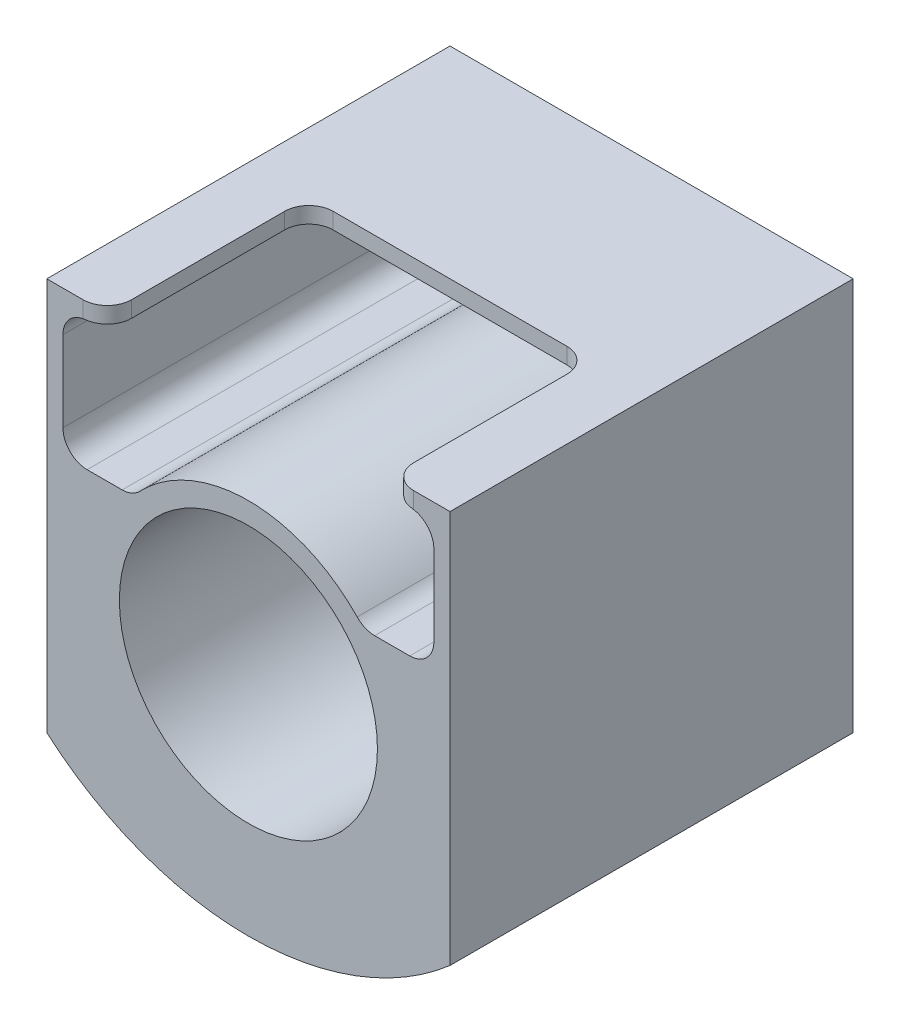
from build123d import *

# Parameters (mm, degrees)
BOSS_EXTRUDE2_DEPTH     = 50
CUT_EXTRUDE1_DEPTH      = 68.650646708
CUT_EXTRUDE1_DEPTH_BACK = 68.650646708
SKETCH2_R               = 16
CUT_EXTRUDE3_DEPTH      = 68.650646708
FILLET1_R               = 3
SKETCH5_W               = 35
SKETCH5_H               = 25
CUT_EXTRUDE4_DEPTH      = 10
FILLET2_R               = 3
SKETCH6_R               = 9.5
SKETCH6_R_2             = 1.25
BOSS_EXTRUDE3_DEPTH     = 5
CUT_EXTRUDE5_DEPTH      = 68.650646782
CUT_EXTRUDE5_DEPTH_BACK = 68.650646782
SKETCH7_R               = 2.5


with BuildPart() as part:
    # Sketch1 → Boss-Extrude2 (new body)
    with BuildSketch(Plane.XY):
        with BuildLine():
            Line((-25, 0), (-25, -28.750826075))
            ThreePointArc((-25, -28.750826075), (0, -38.1), (25, -28.750826075))
            Line((25, -28.750826075), (25, 0))
            Line((25, 0), (25, 20))
            Line((25, 20), (-25, 20))
            Line((-25, 20), (-25, 0))
        make_face()
    extrude(amount=BOSS_EXTRUDE2_DEPTH)

    # Sketch2 → Cut-Extrude1 (cut, two sides: drawn at the far end of the back side and taken through both)
    with BuildSketch(Plane.XY.offset(50).offset(-CUT_EXTRUDE1_DEPTH_BACK)):
        with Locations((0, -10)):
            Circle(SKETCH2_R)
    extrude(amount=CUT_EXTRUDE1_DEPTH + CUT_EXTRUDE1_DEPTH_BACK, mode=Mode.SUBTRACT)

    # Sketch4 → Cut-Extrude3 (cut, through all)
    with BuildSketch(Plane.XY.offset(50)):
        with BuildLine():
            Line((-23, 18), (23, 18))
            Line((23, 18), (23, 2))
            Line((23, 2), (14.317821063, 2))
            ThreePointArc((14.317821063, 2), (0, 8.681541692), (-14.317821063, 2))
            Line((-14.317821063, 2), (-23, 2))
            Line((-23, 2), (-23, 18))
        make_face()
    extrude(amount=-CUT_EXTRUDE3_DEPTH, mode=Mode.SUBTRACT)

    # Fillet1
    fillet1_edges = [part.edges().sort_by_distance(p)[0] for p in [
        (23, 18, 25),
        (23, 2, 25),
        (14.317821063, 2, 25),
        (-14.317821063, 2, 25),
        (-23, 2, 25),
        (-23, 18, 25),
    ]]
    fillet(fillet1_edges, radius=FILLET1_R)

    # Sketch5 → Cut-Extrude4 (cut)
    with BuildSketch(Plane(origin=(0, 20, 0), x_dir=(1, 0, 0), z_dir=(0, 1, 0))):
        with Locations((0, -37.5)):
            Rectangle(SKETCH5_W, SKETCH5_H)
    extrude(amount=-CUT_EXTRUDE4_DEPTH, mode=Mode.SUBTRACT)

    # Fillet2
    fillet2_edges = [part.edges().sort_by_distance(p)[0] for p in [
        (17.5, 19, 50),
        (17.5, 19, 25),
        (-17.5, 19, 25),
        (-17.5, 19, 50),
    ]]
    fillet(fillet2_edges, radius=FILLET2_R)

    # Sketch6 → Boss-Extrude3 (add)
    with BuildSketch(Plane.XY.offset(14)):
        with BuildLine():
            ThreePointArc((16, -10), (0, 6), (-16, -10))
            ThreePointArc((-16, -10), (0, -26), (16, -10))
        make_face()
        with Locations((0, -10)):
            Circle(SKETCH6_R, mode=Mode.SUBTRACT)
        with Locations((0, 3)):
            Circle(SKETCH6_R_2, mode=Mode.SUBTRACT)
        with Locations((13, -10)):
            Circle(SKETCH6_R_2, mode=Mode.SUBTRACT)
        with Locations((-13, -10)):
            Circle(SKETCH6_R_2, mode=Mode.SUBTRACT)
        with Locations((0, -23)):
            Circle(SKETCH6_R_2, mode=Mode.SUBTRACT)
    extrude(amount=-BOSS_EXTRUDE3_DEPTH)

    # Sketch7 → Cut-Extrude5 (cut, two sides: drawn at the far end of the back side and taken through both)
    with BuildSketch(Plane(origin=(0, 0, 0), x_dir=(0, 0, -1), z_dir=(1, 0, 0)).offset(-CUT_EXTRUDE5_DEPTH_BACK)):
        with Locations((-40, -32)):
            Circle(SKETCH7_R)
        with Locations((-10, -32)):
            Circle(SKETCH7_R)
    extrude(amount=CUT_EXTRUDE5_DEPTH + CUT_EXTRUDE5_DEPTH_BACK, mode=Mode.SUBTRACT)


solid = part.part
